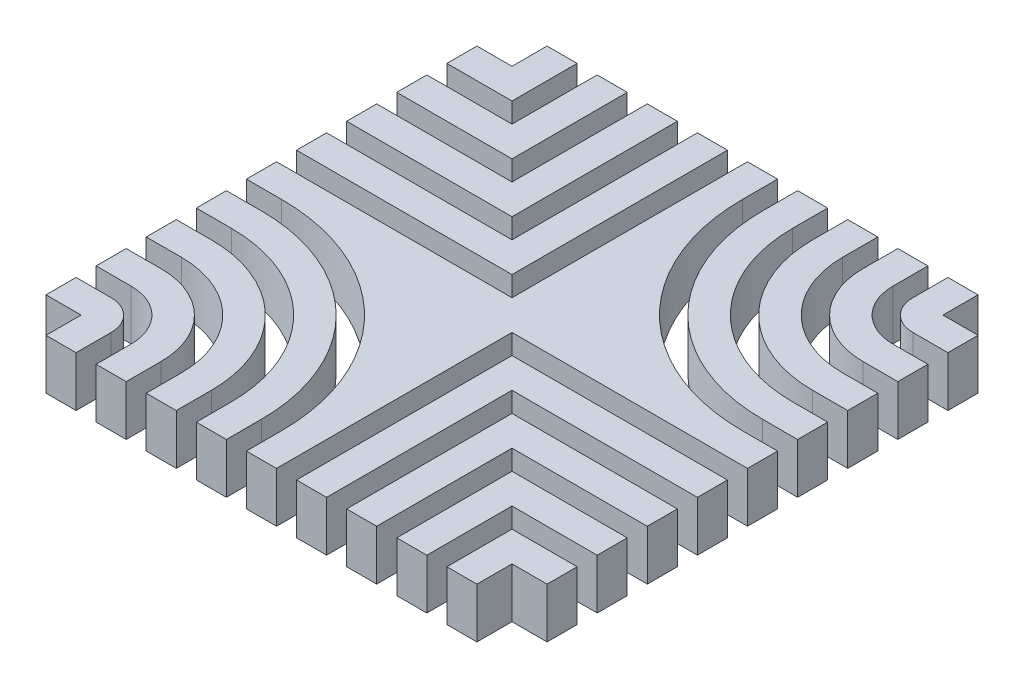
from build123d import *

# Parameters (mm, degrees)
BOSS_EXTRUDE1_DEPTH    = 10
BOSS_EXTRUDE1_2_DEPTH  = 10
BOSS_EXTRUDE1_3_DEPTH  = 10
BOSS_EXTRUDE1_4_DEPTH  = 10
BOSS_EXTRUDE1_5_DEPTH  = 10
BOSS_EXTRUDE1_6_DEPTH  = 10
BOSS_EXTRUDE1_7_DEPTH  = 10
BOSS_EXTRUDE1_8_DEPTH  = 10
BOSS_EXTRUDE1_9_DEPTH  = 10
BOSS_EXTRUDE1_10_DEPTH = 10
BOSS_EXTRUDE1_11_DEPTH = 10
BOSS_EXTRUDE1_12_DEPTH = 10
BOSS_EXTRUDE1_13_DEPTH = 10
BOSS_EXTRUDE1_14_DEPTH = 10
BOSS_EXTRUDE1_15_DEPTH = 10
BOSS_EXTRUDE1_16_DEPTH = 10
BOSS_EXTRUDE1_17_DEPTH = 10


with BuildPart() as part:
    # Sketch1 → Boss-Extrude1 (new body)
    with BuildSketch(Plane(origin=(0, 0, 0), x_dir=(1, 0, 0), z_dir=(0, 1, 0))):
        Polygon((-50, 37), (-37, 37), (-37, 50), (-43, 50), (-43, 43), (-50, 43), align=None)
    extrude(amount=BOSS_EXTRUDE1_DEPTH)


with BuildPart() as body_2:
    # Sketch1 → Boss-Extrude1 2 (new body)
    with BuildSketch(Plane(origin=(0, 0, 0), x_dir=(1, 0, 0), z_dir=(0, 1, 0))):
        Polygon((-50, 27), (-27, 27), (-27, 50), (-33, 50), (-33, 33), (-50, 33), align=None)
    extrude(amount=BOSS_EXTRUDE1_2_DEPTH)


with BuildPart() as body_3:
    # Sketch1 → Boss-Extrude1 3 (new body)
    with BuildSketch(Plane(origin=(0, 0, 0), x_dir=(1, 0, 0), z_dir=(0, 1, 0))):
        Polygon((-50, 17), (-17, 17), (-17, 50), (-23, 50), (-23, 23), (-50, 23), align=None)
    extrude(amount=BOSS_EXTRUDE1_3_DEPTH)


with BuildPart() as body_4:
    # Sketch1 → Boss-Extrude1 4 (new body)
    with BuildSketch(Plane(origin=(0, 0, 0), x_dir=(1, 0, 0), z_dir=(0, 1, 0))):
        Polygon((-50, 7), (-7, 7), (-7, 50), (-13, 50), (-13, 13), (-50, 13), align=None)
    extrude(amount=BOSS_EXTRUDE1_4_DEPTH)


with BuildPart() as body_5:
    # Sketch1 → Boss-Extrude1 5 (new body)
    with BuildSketch(Plane(origin=(0, 0, 0), x_dir=(1, 0, 0), z_dir=(0, 1, 0))):
        with BuildLine():
            Line((-50, -3), (-43, -3))
            ThreePointArc((-43, -3), (-14.715728753, -14.715728753), (-3, -43))
            Line((-3, -43), (-3, -50))
            Line((-3, -50), (3, -50))
            Line((3, -50), (3, -3))
            Line((3, -3), (50, -3))
            Line((50, -3), (50, 3))
            Line((50, 3), (43, 3))
            ThreePointArc((43, 3), (14.715728753, 14.715728753), (3, 43))
            Line((3, 43), (3, 50))
            Line((3, 50), (-3, 50))
            Line((-3, 50), (-3, 3))
            Line((-3, 3), (-50, 3))
            Line((-50, 3), (-50, -3))
        make_face()
    extrude(amount=BOSS_EXTRUDE1_5_DEPTH)


with BuildPart() as body_6:
    # Sketch1 → Boss-Extrude1 6 (new body)
    with BuildSketch(Plane(origin=(0, 0, 0), x_dir=(1, 0, 0), z_dir=(0, 1, 0))):
        with BuildLine():
            Line((-50, -13), (-43, -13))
            ThreePointArc((-43, -13), (-21.786796564, -21.786796564), (-13, -43))
            Line((-13, -43), (-13, -50))
            Line((-13, -50), (-7, -50))
            Line((-7, -50), (-7, -43))
            ThreePointArc((-7, -43), (-17.544155877, -17.544155877), (-43, -7))
            Line((-43, -7), (-50, -7))
            Line((-50, -7), (-50, -13))
        make_face()
    extrude(amount=BOSS_EXTRUDE1_6_DEPTH)


with BuildPart() as body_7:
    # Sketch1 → Boss-Extrude1 7 (new body)
    with BuildSketch(Plane(origin=(0, 0, 0), x_dir=(1, 0, 0), z_dir=(0, 1, 0))):
        with BuildLine():
            Line((-50, -23), (-43, -23))
            ThreePointArc((-43, -23), (-28.857864376, -28.857864376), (-23, -43))
            Line((-23, -43), (-23, -50))
            Line((-23, -50), (-17, -50))
            Line((-17, -50), (-17, -43))
            ThreePointArc((-17, -43), (-24.615223689, -24.615223689), (-43, -17))
            Line((-43, -17), (-50, -17))
            Line((-50, -17), (-50, -23))
        make_face()
    extrude(amount=BOSS_EXTRUDE1_7_DEPTH)


with BuildPart() as body_8:
    # Sketch1 → Boss-Extrude1 8 (new body)
    with BuildSketch(Plane(origin=(0, 0, 0), x_dir=(1, 0, 0), z_dir=(0, 1, 0))):
        with BuildLine():
            Line((-50, -33), (-43, -33))
            ThreePointArc((-43, -33), (-35.928932188, -35.928932188), (-33, -43))
            Line((-33, -43), (-33, -50))
            Line((-33, -50), (-27, -50))
            Line((-27, -50), (-27, -43))
            ThreePointArc((-27, -43), (-31.686291501, -31.686291501), (-43, -27))
            Line((-43, -27), (-50, -27))
            Line((-50, -27), (-50, -33))
        make_face()
    extrude(amount=BOSS_EXTRUDE1_8_DEPTH)


with BuildPart() as body_9:
    # Sketch1 → Boss-Extrude1 9 (new body)
    with BuildSketch(Plane(origin=(0, 0, 0), x_dir=(1, 0, 0), z_dir=(0, 1, 0))):
        with BuildLine():
            Line((-50, -43), (-43, -43))
            Line((-43, -43), (-43, -50))
            Line((-43, -50), (-37, -50))
            Line((-37, -50), (-37, -43))
            ThreePointArc((-37, -43), (-38.757359313, -38.757359313), (-43, -37))
            Line((-43, -37), (-50, -37))
            Line((-50, -37), (-50, -43))
        make_face()
    extrude(amount=BOSS_EXTRUDE1_9_DEPTH)


with BuildPart() as body_10:
    # Sketch1 → Boss-Extrude1 10 (new body)
    with BuildSketch(Plane(origin=(0, 0, 0), x_dir=(1, 0, 0), z_dir=(0, 1, 0))):
        Polygon((7, -7), (50, -7), (50, -13), (13, -13), (13, -50), (7, -50), align=None)
    extrude(amount=BOSS_EXTRUDE1_10_DEPTH)


with BuildPart() as body_11:
    # Sketch1 → Boss-Extrude1 11 (new body)
    with BuildSketch(Plane(origin=(0, 0, 0), x_dir=(1, 0, 0), z_dir=(0, 1, 0))):
        Polygon((17, -17), (50, -17), (50, -23), (23, -23), (23, -50), (17, -50), align=None)
    extrude(amount=BOSS_EXTRUDE1_11_DEPTH)


with BuildPart() as body_12:
    # Sketch1 → Boss-Extrude1 12 (new body)
    with BuildSketch(Plane(origin=(0, 0, 0), x_dir=(1, 0, 0), z_dir=(0, 1, 0))):
        Polygon((27, -27), (50, -27), (50, -33), (33, -33), (33, -50), (27, -50), align=None)
    extrude(amount=BOSS_EXTRUDE1_12_DEPTH)


with BuildPart() as body_13:
    # Sketch1 → Boss-Extrude1 13 (new body)
    with BuildSketch(Plane(origin=(0, 0, 0), x_dir=(1, 0, 0), z_dir=(0, 1, 0))):
        Polygon((37, -37), (50, -37), (50, -43), (43, -43), (43, -50), (37, -50), align=None)
    extrude(amount=BOSS_EXTRUDE1_13_DEPTH)


with BuildPart() as body_14:
    # Sketch1 → Boss-Extrude1 14 (new body)
    with BuildSketch(Plane(origin=(0, 0, 0), x_dir=(1, 0, 0), z_dir=(0, 1, 0))):
        with BuildLine():
            Line((7, 50), (7, 43))
            ThreePointArc((7, 43), (17.544155877, 17.544155877), (43, 7))
            Line((43, 7), (50, 7))
            Line((50, 7), (50, 13))
            Line((50, 13), (43, 13))
            ThreePointArc((43, 13), (21.786796564, 21.786796564), (13, 43))
            Line((13, 43), (13, 50))
            Line((13, 50), (7, 50))
        make_face()
    extrude(amount=BOSS_EXTRUDE1_14_DEPTH)


with BuildPart() as body_15:
    # Sketch1 → Boss-Extrude1 15 (new body)
    with BuildSketch(Plane(origin=(0, 0, 0), x_dir=(1, 0, 0), z_dir=(0, 1, 0))):
        with BuildLine():
            Line((17, 50), (17, 43))
            ThreePointArc((17, 43), (24.615223689, 24.615223689), (43, 17))
            Line((43, 17), (50, 17))
            Line((50, 17), (50, 23))
            Line((50, 23), (43, 23))
            ThreePointArc((43, 23), (28.857864376, 28.857864376), (23, 43))
            Line((23, 43), (23, 50))
            Line((23, 50), (17, 50))
        make_face()
    extrude(amount=BOSS_EXTRUDE1_15_DEPTH)


with BuildPart() as body_16:
    # Sketch1 → Boss-Extrude1 16 (new body)
    with BuildSketch(Plane(origin=(0, 0, 0), x_dir=(1, 0, 0), z_dir=(0, 1, 0))):
        with BuildLine():
            Line((27, 50), (27, 43))
            ThreePointArc((27, 43), (31.686291501, 31.686291501), (43, 27))
            Line((43, 27), (50, 27))
            Line((50, 27), (50, 33))
            Line((50, 33), (43, 33))
            ThreePointArc((43, 33), (35.928932188, 35.928932188), (33, 43))
            Line((33, 43), (33, 50))
            Line((33, 50), (27, 50))
        make_face()
    extrude(amount=BOSS_EXTRUDE1_16_DEPTH)


with BuildPart() as body_17:
    # Sketch1 → Boss-Extrude1 17 (new body)
    with BuildSketch(Plane(origin=(0, 0, 0), x_dir=(1, 0, 0), z_dir=(0, 1, 0))):
        with BuildLine():
            Line((37, 50), (37, 43))
            ThreePointArc((37, 43), (38.757359313, 38.757359313), (43, 37))
            Line((43, 37), (50, 37))
            Line((50, 37), (50, 43))
            Line((50, 43), (43, 43))
            Line((43, 43), (43, 50))
            Line((43, 50), (37, 50))
        make_face()
    extrude(amount=BOSS_EXTRUDE1_17_DEPTH)


solid = Compound([part.part, body_2.part, body_3.part, body_4.part, body_5.part, body_6.part, body_7.part, body_8.part, body_9.part, body_10.part, body_11.part, body_12.part, body_13.part, body_14.part, body_15.part, body_16.part, body_17.part])
